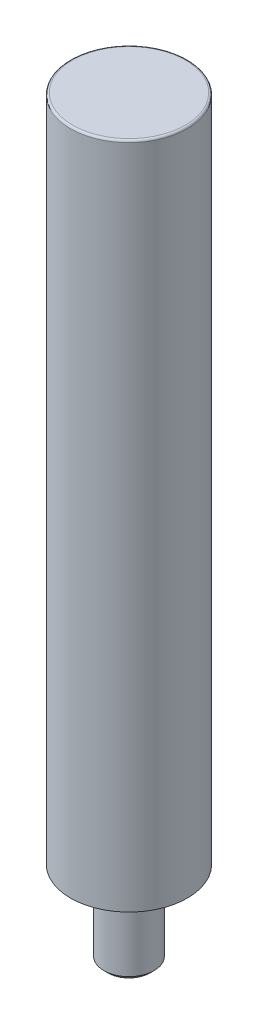
from build123d import *

# Parameters (mm, degrees)
SKETCH1_R           = 14
BOSS_EXTRUDE1_DEPTH = 160
SKETCH2_R           = 10
BOSS_EXTRUDE2_DEPTH = 20
FILLET1_R           = 0.5


# Read off the part's stored shape, not the designer's step: M12 Machine Threads Stud1
with BuildPart() as part:
    # Sketch1 → Boss-Extrude1 (new body)
    with BuildSketch(Plane(origin=(0, 0, 0), x_dir=(1, 0, 0), z_dir=(0, 1, 0))):
        with Locations(Location((0, 0, 0), (0, 0, 270))):
            Circle(SKETCH1_R)
    extrude(amount=BOSS_EXTRUDE1_DEPTH)

    # Sketch2 → Boss-Extrude2 (add)
    with BuildSketch(Plane.XZ):
        with Locations(Location((0, 0, 0), (0, 0, 270))):
            Circle(SKETCH2_R)
    extrude(amount=BOSS_EXTRUDE2_DEPTH)

    # M12 Machine Threads Stud1 outline → M12 Machine Threads Stud1 (revolve, cut)
    with BuildSketch(Plane.XY):
        Polygon((10, 0), (6, 0), (6, -19.036), (5.036, -20), (10, -20), align=None)
    revolve(axis=Axis((0, 0, 0), (0, 1, 0)), mode=Mode.SUBTRACT)

    # Fillet1
    fillet1_edges = [part.edges().sort_by_distance(p)[0] for p in [
        (0, 160, -14),
    ]]
    fillet(fillet1_edges, radius=FILLET1_R)


solid = part.part
